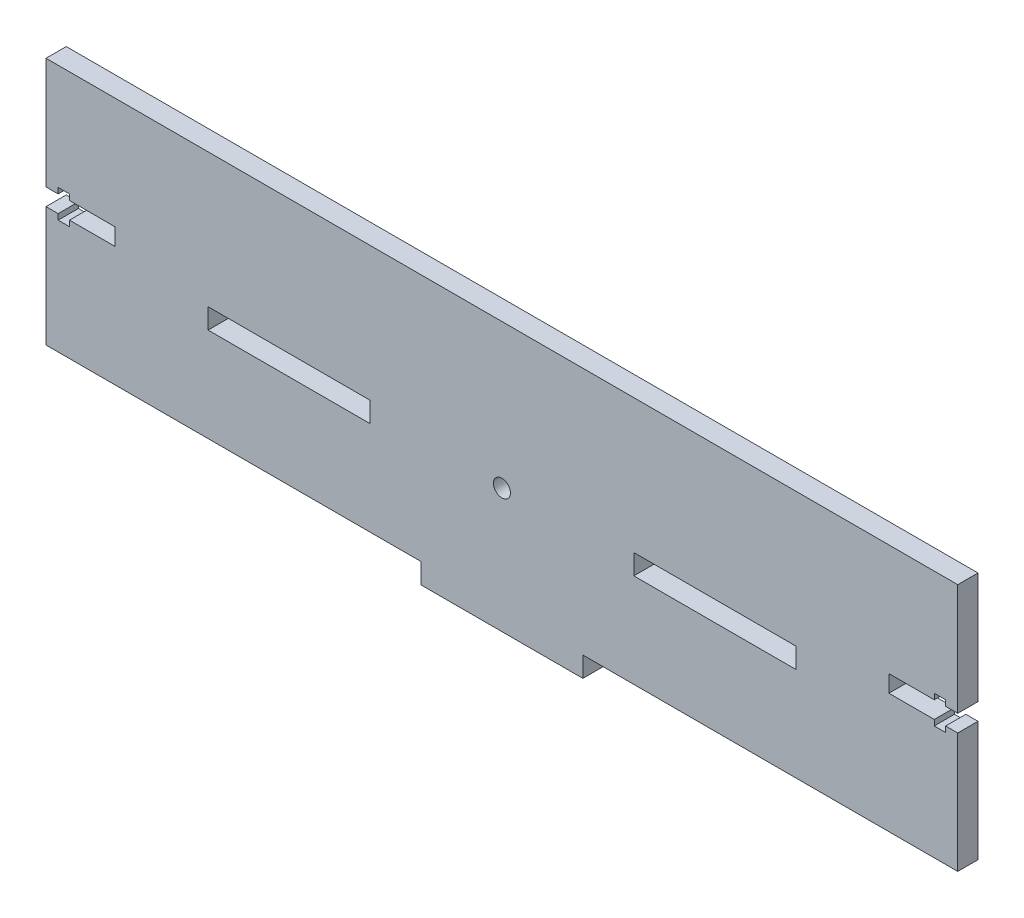
from build123d import *

# Parameters (mm, degrees)
SKETCH1_W                 = 225.11
SKETCH1_H                 = 61.32
BOSS_EXTRUDE1_DEPTH       = 5
SKETCH2_R                 = 2.1
SKETCH2_W                 = 40
SKETCH2_H                 = 5
CUT_EXTRUDE1_DEPTH        = 5
BOSS_EXTRUDE2_START       = -5
BOSS_EXTRUDE2_DEPTH       = 5
BOSS_EXTRUDE2_2_OUTLINE_W = 40
BOSS_EXTRUDE2_2_OUTLINE_H = 5
BOSS_EXTRUDE2_2_DEPTH     = 5


# Read off the part's stored shape, not the designer's step: Boss-Extrude2
with BuildPart() as part:
    # Sketch1 → Boss-Extrude1 (new body)
    with BuildSketch(Plane.XY):
        Rectangle(SKETCH1_W, SKETCH1_H)
    extrude(amount=BOSS_EXTRUDE1_DEPTH)

    # Sketch2 → Cut-Extrude1 (cut)
    with BuildSketch(Plane.XY.offset(5)):
        with Locations((0.014505864, -4.956)):
            Circle(SKETCH2_R)
        with Locations((52.569505864, -4.956)):
            Rectangle(SKETCH2_W, SKETCH2_H)
        with Locations((-52.540494136, -4.956)):
            Rectangle(SKETCH2_W, SKETCH2_H)
    extrude(amount=-CUT_EXTRUDE1_DEPTH, mode=Mode.SUBTRACT)

    # Boss-Extrude2 outline → Boss-Extrude2 (cut)
    with BuildSketch(Plane.XY.offset(5).offset(BOSS_EXTRUDE2_START)):
        Polygon((109.555, -2.456), (109.555, -1.056), (112.555, -1.056), (112.555, 3.144), (109.555, 3.144), (109.555, 4.544), (106.755, 4.544), (106.755, 3.144), (95.555, 3.144), (95.555, -1.056), (106.755, -1.056), (106.755, -2.456), align=None)
        Polygon((-112.555, 3.144), (-112.555, -1.056), (-109.555, -1.056), (-109.555, -2.456), (-106.755, -2.456), (-106.755, -1.056), (-95.555, -1.056), (-95.555, 3.144), (-106.755, 3.144), (-106.755, 4.544), (-109.555, 4.544), (-109.555, 3.144), align=None)
    extrude(amount=BOSS_EXTRUDE2_DEPTH, mode=Mode.SUBTRACT)

    # Boss-Extrude2 2 outline → Boss-Extrude2 2 (add)
    with BuildSketch(Plane.XY.offset(5).offset(BOSS_EXTRUDE2_START)):
        with Locations((0, -33.16)):
            Rectangle(BOSS_EXTRUDE2_2_OUTLINE_W, BOSS_EXTRUDE2_2_OUTLINE_H)
    extrude(amount=BOSS_EXTRUDE2_2_DEPTH)


solid = part.part
